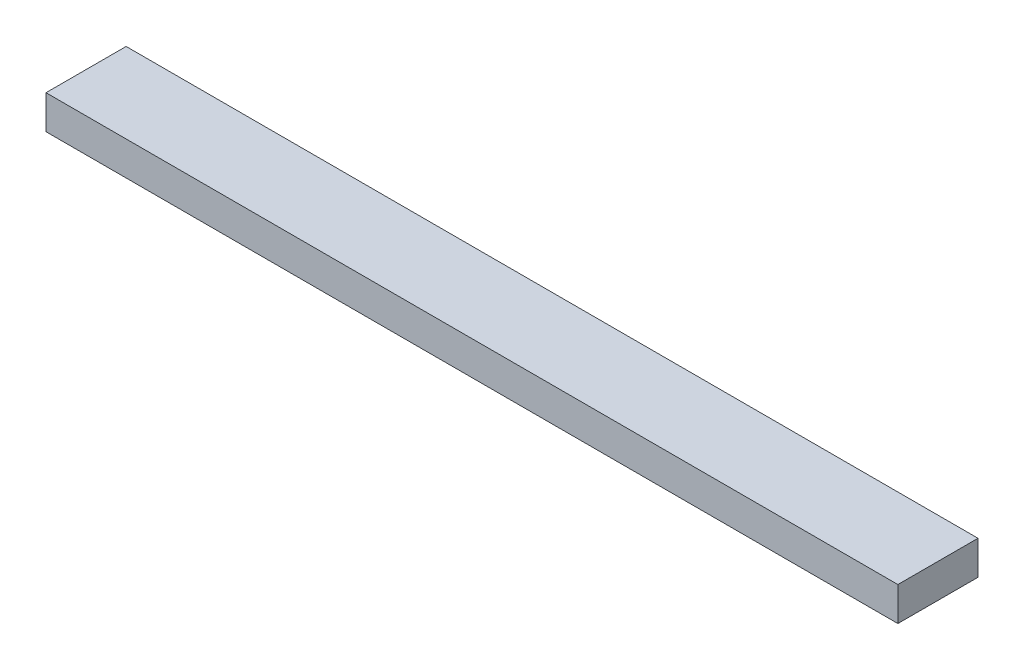
from build123d import *

# Parameters (mm, degrees)
SKETCH1_W           = 30.1
SKETCH1_H           = 12.7
BOSS_EXTRUDE1_DEPTH = 320


with BuildPart() as part:
    # Sketch1 → Boss-Extrude1 (new body)
    with BuildSketch(Plane(origin=(0, 0, 0), x_dir=(0, 0, -1), z_dir=(1, 0, 0))):
        with Locations((15.05, 6.35)):
            Rectangle(SKETCH1_W, SKETCH1_H)
    extrude(amount=BOSS_EXTRUDE1_DEPTH)


solid = part.part
